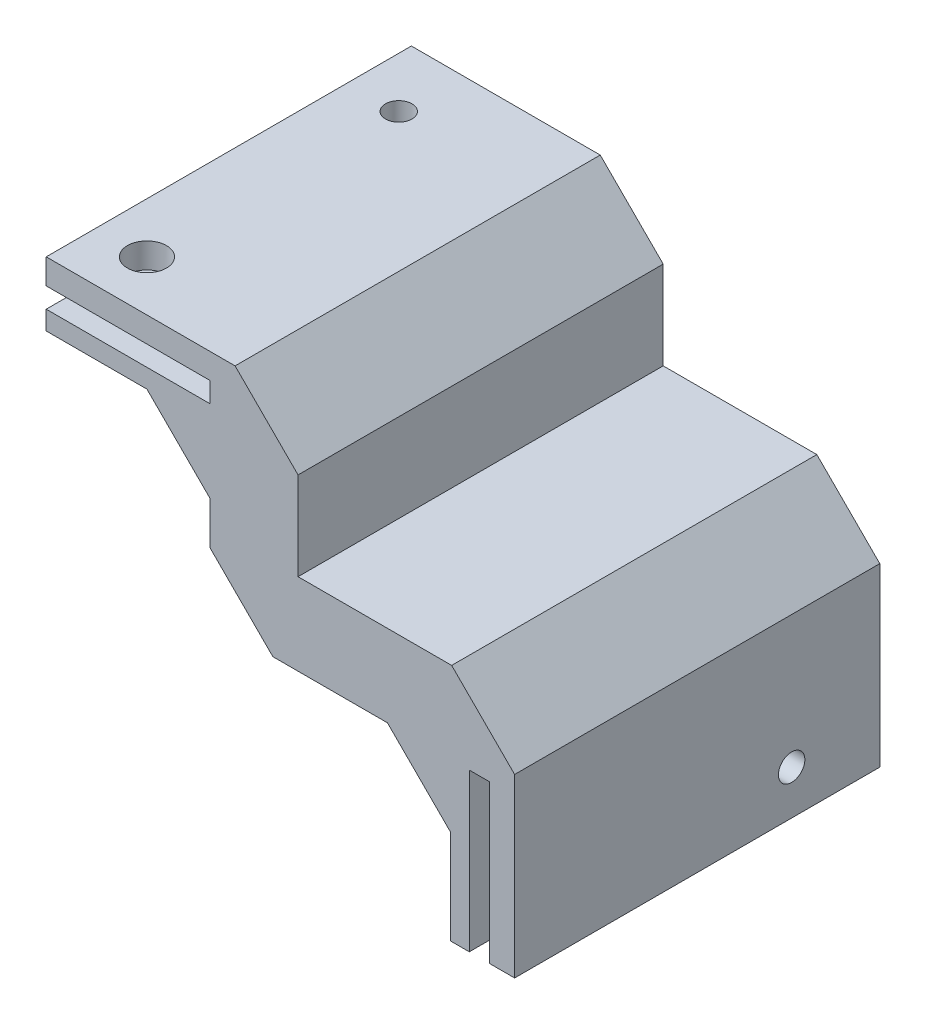
from build123d import *

# Parameters (mm, degrees)
DODANIE_WYCI_GNI_CIE1_DEPTH = 58
SFAZOWANIE1_SIZE            = 10
SZKIC2_W                    = 4
SZKIC2_H                    = 58
SZKIC2_W_2                  = 3
DODANIE_WYCI_GNI_CIE2_DEPTH = 10
SZKIC3_R                    = 2.1
SZKIC3_R_2                  = 3.1
WYTNIJ_WYCI_GNI_CIE1_DEPTH  = 108.622488356
SZKIC4_R                    = 2.1
WYTNIJ_WYCI_GNI_CIE2_DEPTH  = 101.943746711


with BuildPart() as part:
    # Szkic1 → Dodanie-wyciągnięcie1 (new body)
    with BuildSketch(Plane.XY):
        Polygon((0, 0), (-4, 0), (-4, 15), (-7.2, 15), (-7.2, 0), (-10.2, 0), (-10.2, 15), (-38.4, 15), (-48.4, 25), (-48.4, 41.8), (-74.4, 41.8), (-74.4, 44.8), (-48.4, 44.8), (-48.4, 48), (-74.4, 48), (-74.4, 52), (-34.4, 52), (-34.4, 28), (0, 28), align=None)
    extrude(amount=DODANIE_WYCI_GNI_CIE1_DEPTH)

    # Sfazowanie1
    sfazowanie1_edges = [part.edges().sort_by_distance(p)[0] for p in [
        (-10.2, 15, 29),
        (-48.4, 41.8, 29),
        (0, 28, 29),
        (-34.4, 52, 29),
    ]]
    chamfer(sfazowanie1_edges, length=SFAZOWANIE1_SIZE)

    # Szkic2 → Dodanie-wyciągnięcie2 (add)
    with BuildSketch(Plane.XZ):
        with Locations((-2, 29)):
            Rectangle(SZKIC2_W, SZKIC2_H)
        with Locations((-8.7, 29)):
            Rectangle(SZKIC2_W_2, SZKIC2_H)
    extrude(amount=DODANIE_WYCI_GNI_CIE2_DEPTH)

    # Szkic3 → Wytnij-wyciągnięcie1 (cut, through all)
    with BuildSketch(Plane.XZ.offset(-41.8)):
        with Locations((-66.4, 10)):
            Circle(SZKIC3_R)
        with Locations((-66.4, 50)):
            Circle(SZKIC3_R_2)
    extrude(amount=-WYTNIJ_WYCI_GNI_CIE1_DEPTH, mode=Mode.SUBTRACT)

    # Szkic4 → Wytnij-wyciągnięcie2 (cut, through all)
    with BuildSketch(Plane.ZY.offset(10.2)):
        with Locations((14, -3)):
            Circle(SZKIC4_R)
    extrude(amount=-WYTNIJ_WYCI_GNI_CIE2_DEPTH, mode=Mode.SUBTRACT)


solid = part.part
